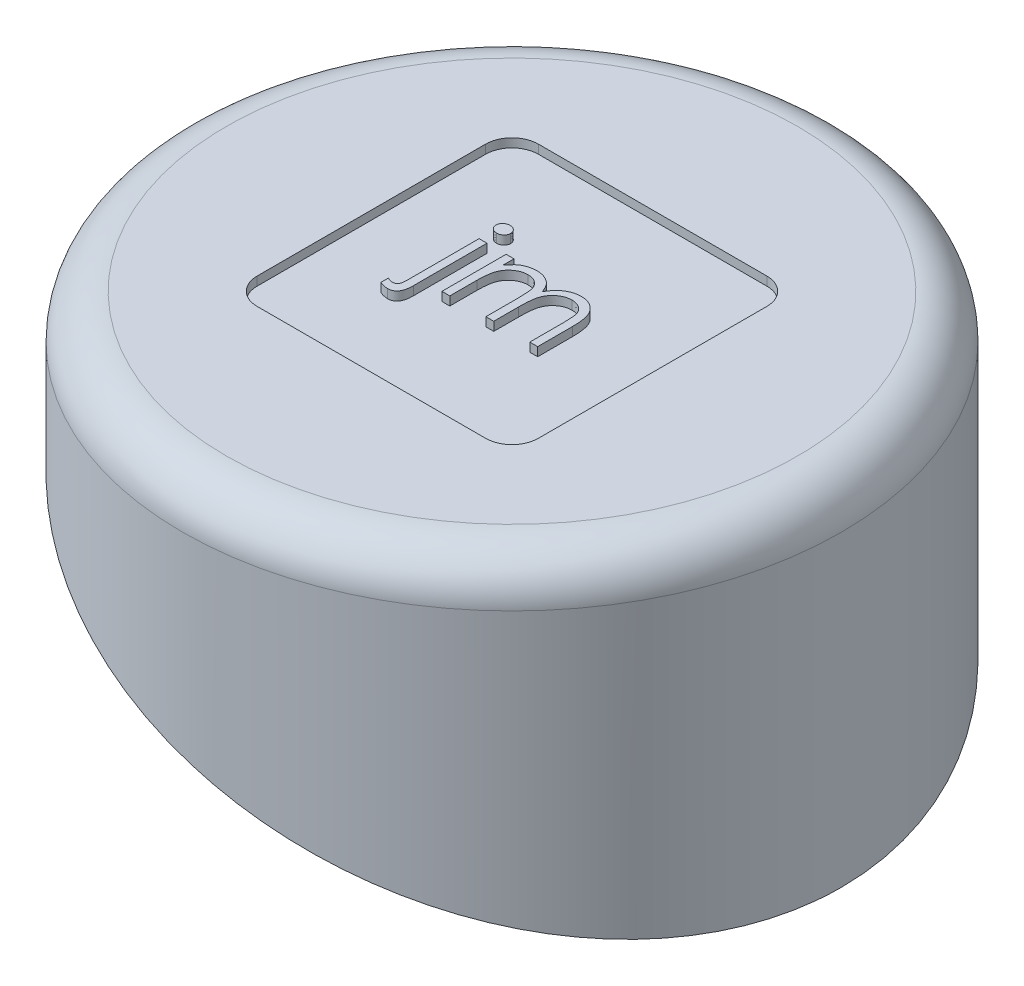
from build123d import *

# Parameters (mm, degrees)
SKETCH1_R                      = 37.5
BOSS_EXTRUDE1_DEPTH            = 40
CUT_EXTRUDE1_REACH             = 68.427
CUT_EXTRUDE1_DIRECTION_2_REACH = 68.427
FILLET1_R                      = 5
CUT_EXTRUDE2_DEPTH             = 1


# Read off the part's stored shape, not the designer's step: Shell1
with BuildPart() as part:
    # Sketch1 → Boss-Extrude1 (new body)
    with BuildSketch(Plane(origin=(0, 0, 0), x_dir=(1, 0, 0), z_dir=(0, 1, 0))):
        with Locations(Location((0, 0, 0), (0, 0, 270))):
            Circle(SKETCH1_R)
    extrude(amount=BOSS_EXTRUDE1_DEPTH)

    # Sketch2 → Cut-Extrude1 (cut, up to next)
    with BuildSketch(Plane.XY, mode=Mode.PRIVATE) as cut_extrude1_sk1:
        Polygon((37.5, 0), (-37.5, 0), (-37.5, 25.824570997), align=None)
    cut_extrude1_tool1 = extrude(cut_extrude1_sk1.sketch, amount=-CUT_EXTRUDE1_REACH, mode=Mode.PRIVATE) & part.part
    add(cut_extrude1_tool1.solids().sort_by_distance((-12.5, 8.60819, 0))[0], mode=Mode.SUBTRACT)

    # Sketch2 → Cut-Extrude1 direction 2 (cut, up to next)
    with BuildSketch(Plane.XY, mode=Mode.PRIVATE) as cut_extrude1_direction_2_sk1:
        Polygon((37.5, 0), (-37.5, 0), (-37.5, 25.824570997), align=None)
    cut_extrude1_direction_2_tool1 = extrude(cut_extrude1_direction_2_sk1.sketch, amount=CUT_EXTRUDE1_DIRECTION_2_REACH, mode=Mode.PRIVATE) & part.part
    add(cut_extrude1_direction_2_tool1.solids().sort_by_distance((-12.5, 8.60819, 0))[0], mode=Mode.SUBTRACT)

    # Fillet1
    fillet1_edges = [part.edges().sort_by_distance(p)[0] for p in [
        (0, 40, -37.5),
    ]]
    fillet(fillet1_edges, radius=FILLET1_R)

    # Shell1 outline → Shell1 (revolve, cut)
    with BuildSketch(Plane.XY):
        with BuildLine():
            Line((35, 0.854583606), (35, 35))
            ThreePointArc((35, 35), (34.267766953, 36.767766953), (32.5, 37.5))
            Line((32.5, 37.5), (0, 37.5))
            Line((0, 37.5), (0, 0.854583606))
            Line((0, 0.854583606), (35, 0.854583606))
        make_face()
    revolve(axis=Axis((0, 0, 0), (0, 1, 0)), mode=Mode.SUBTRACT)

    # Sketch3 → Cut-Extrude2 (cut)
    with BuildSketch(Plane(origin=(0, 40, 0), x_dir=(1, 0, 0), z_dir=(0, 1, 0))):
        with BuildLine():
            Line((-13, -16), (13, -16))
            ThreePointArc((13, -16), (15.121320344, -15.121320344), (16, -13))
            Line((16, -13), (16, 13))
            ThreePointArc((16, 13), (15.121320344, 15.121320344), (13, 16))
            Line((13, 16), (-13, 16))
            ThreePointArc((-13, 16), (-15.121320344, 15.121320344), (-16, 13))
            Line((-16, 13), (-16, -13))
            ThreePointArc((-16, -13), (-15.121320344, -15.121320344), (-13, -16))
        make_face()
        with BuildLine():
            add(Edge.make_bspline(
                [(-6.602564103, 6.384615385), (-6.546219207, 6.382051156), (-6.436523351, 6.377058951), (-6.278503166, 6.334172743), (-6.136327345, 6.259484797), (-6.009011428, 6.162468173), (-5.90222163, 6.045057839), (-5.824697029, 5.911307595), (-5.778834699, 5.764519327), (-5.772475164, 5.663112259), (-5.769230769, 5.611378205)],
                knots=[0, 0, 0, 0, 1.06928763, 2.081757757, 3.080304056, 4.102817284, 5.108909582, 6.075019406, 7.017947647, 8, 8, 8, 8], degree=3))
            add(Edge.make_bspline(
                [(-5.769230769, 5.611378205), (-5.772538286, 5.56098822), (-5.779063437, 5.461577616), (-5.824662885, 5.317314259), (-5.902869178, 5.185439169), (-6.008939934, 5.068256987), (-6.136346112, 4.971296003), (-6.278498143, 4.896593392), (-6.436524697, 4.85371111), (-6.546219664, 4.848718356), (-6.602564103, 4.846153846)],
                knots=[0, 0, 0, 0, 0.962634111, 1.899108286, 2.860048811, 3.872254101, 4.900980094, 5.905593535, 6.924215405, 8, 8, 8, 8], degree=3))
            add(Edge.make_bspline(
                [(-6.602564103, 4.846153846), (-6.658908541, 4.848718356), (-6.768603508, 4.85371111), (-6.926630062, 4.896593392), (-7.068782093, 4.971296003), (-7.196188271, 5.068256987), (-7.302259027, 5.185439169), (-7.38046532, 5.317314259), (-7.426064769, 5.461577616), (-7.432589919, 5.56098822), (-7.435897436, 5.611378205)],
                knots=[0, 0, 0, 0, 1.075784595, 2.094406465, 3.099019906, 4.127745899, 5.139951189, 6.100891714, 7.037365889, 8, 8, 8, 8], degree=3))
            add(Edge.make_bspline(
                [(-7.435897436, 5.611378205), (-7.432653041, 5.663112259), (-7.426293506, 5.764519327), (-7.380431176, 5.911307595), (-7.302906576, 6.045057839), (-7.196116777, 6.162468173), (-7.068800861, 6.259484797), (-6.926625039, 6.334172743), (-6.768604854, 6.377058951), (-6.658908998, 6.382051156), (-6.602564103, 6.384615385)],
                knots=[0, 0, 0, 0, 0.982052353, 1.924980594, 2.891090418, 3.897182716, 4.919695944, 5.918242243, 6.93071237, 8, 8, 8, 8], degree=3))
        make_face(mode=Mode.SUBTRACT)
        with BuildLine():
            Line((-7.051282051, 3.307692308), (-6.153846154, 3.307692308))
            Line((-6.153846154, 3.307692308), (-6.153846154, -5.067708333))
            add(Edge.make_bspline(
                [(-6.153846154, -5.067708333), (-6.154132606, -5.141869875), (-6.15468305, -5.284378053), (-6.172317042, -5.49016243), (-6.195192124, -5.680954673), (-6.228547736, -5.856533408), (-6.272681208, -6.016754586), (-6.326858883, -6.160593298), (-6.387799564, -6.291092499), (-6.463270778, -6.403491101), (-6.545332797, -6.502134381), (-6.634703123, -6.587487965), (-6.7308923, -6.660626224), (-6.836160171, -6.7180461), (-6.947081727, -6.765673789), (-7.066034551, -6.796368416), (-7.191389698, -6.817947311), (-7.277545042, -6.819643319), (-7.321714744, -6.820512821)],
                knots=[0, 0, 0, 0, 1.493029139, 2.868991889, 4.156754484, 5.362105958, 6.464967428, 7.499106053, 8.455465818, 9.358121702, 10.217355437, 11.035397588, 11.842309395, 12.643033568, 13.444773531, 14.266895717, 15.11148054, 16, 16, 16, 16], degree=3))
            add(Edge.make_bspline(
                [(-7.321714744, -6.820512821), (-7.399379833, -6.817829424), (-7.559893914, -6.812283524), (-7.806399323, -6.763785397), (-8.067320709, -6.692518214), (-8.242387038, -6.625144579), (-8.333333333, -6.590144231)],
                knots=[0, 0, 0, 0, 0.892368802, 1.844300437, 2.88012224, 4, 4, 4, 4], degree=3))
            Line((-8.333333333, -6.590144231), (-8.333333333, -5.726762821))
            add(Edge.make_bspline(
                [(-8.333333333, -5.726762821), (-8.276587466, -5.757025769), (-8.168310166, -5.814770775), (-8.002598459, -5.873223953), (-7.847373694, -5.916054943), (-7.745315187, -5.920799116), (-7.696314103, -5.923076923)],
                knots=[0, 0, 0, 0, 1.144578483, 2.183980519, 3.128079311, 4, 4, 4, 4], degree=3))
            add(Edge.make_bspline(
                [(-7.696314103, -5.923076923), (-7.639660339, -5.919438476), (-7.530400465, -5.912421532), (-7.378051109, -5.85186899), (-7.24962178, -5.749094843), (-7.190352916, -5.656726685), (-7.159455128, -5.608573718)],
                knots=[0, 0, 0, 0, 1.036054724, 1.998088038, 2.956371939, 4, 4, 4, 4], degree=3))
            add(Edge.make_bspline(
                [(-7.159455128, -5.608573718), (-7.141911229, -5.566290667), (-7.100858564, -5.467348473), (-7.072816103, -5.28222691), (-7.053144834, -5.04686094), (-7.051942097, -4.871484533), (-7.051282051, -4.775240385)],
                knots=[0, 0, 0, 0, 0.647276487, 1.514624746, 2.636060416, 4, 4, 4, 4], degree=3))
            Line((-7.051282051, -4.775240385), (-7.051282051, 3.307692308))
        make_face(mode=Mode.SUBTRACT)
        with BuildLine():
            Line((-3.974358974, 3.307692308), (-3.076923077, 3.307692308))
            Line((-3.076923077, 3.307692308), (-3.076923077, 2.037660256))
            add(Edge.make_bspline(
                [(-3.076923077, 2.037660256), (-2.996111791, 2.14876769), (-2.841269621, 2.361660184), (-2.587367757, 2.642203854), (-2.333721721, 2.880284296), (-2.151054916, 3.005263929), (-2.063301282, 3.065304487)],
                knots=[0, 0, 0, 0, 1.134379233, 2.173579362, 3.122582517, 4, 4, 4, 4], degree=3))
            add(Edge.make_bspline(
                [(-2.063301282, 3.065304487), (-1.943687962, 3.122462674), (-1.706551105, 3.235780426), (-1.331067605, 3.350733452), (-0.946854264, 3.421376598), (-0.687402224, 3.431037665), (-0.556891026, 3.435897436)],
                knots=[0, 0, 0, 0, 1.014936303, 2.012140481, 3.000054389, 4, 4, 4, 4], degree=3))
            add(Edge.make_bspline(
                [(-0.556891026, 3.435897436), (-0.468625321, 3.432910891), (-0.293952238, 3.427000679), (-0.035140552, 3.388543435), (0.215884053, 3.322068655), (0.457638423, 3.229476301), (0.685411792, 3.11734291), (0.894238071, 2.985772316), (1.081735809, 2.838066386), (1.247810241, 2.667555149), (1.397150314, 2.469450582), (1.534518447, 2.238409871), (1.661447625, 1.969245125), (1.731794222, 1.773912151), (1.768830128, 1.671073718)],
                knots=[0, 0, 0, 0, 1.009824226, 1.998387844, 2.986035974, 3.974953746, 4.955485308, 5.885931332, 6.793869504, 7.679848016, 8.601185859, 9.625726857, 10.749998409, 12, 12, 12, 12], degree=3))
            add(Edge.make_bspline(
                [(1.768830128, 1.671073718), (1.808005132, 1.741714916), (1.885096038, 1.880726873), (2.014540715, 2.077464765), (2.150162991, 2.26148417), (2.293118686, 2.432931097), (2.442903219, 2.590958898), (2.600221506, 2.736090046), (2.764178024, 2.868947799), (2.992155853, 3.024156826), (3.288763302, 3.189017345), (3.662729344, 3.331955756), (4.051729835, 3.420287551), (4.315780401, 3.430659759), (4.44911859, 3.435897436)],
                knots=[0, 0, 0, 0, 0.86119277, 1.694706429, 2.50939023, 3.298075842, 4.073795165, 4.829715201, 5.57930267, 6.321991688, 7.768977793, 9.186738141, 10.579381044, 12, 12, 12, 12], degree=3))
            add(Edge.make_bspline(
                [(4.44911859, 3.435897436), (4.571637055, 3.431276805), (4.811417587, 3.422233781), (5.160495489, 3.351223858), (5.486043504, 3.229287723), (5.787406579, 3.062905904), (6.05929176, 2.853822523), (6.295624072, 2.605054416), (6.494967967, 2.318361207), (6.625192652, 2.048669811), (6.713521979, 1.81056886), (6.767982648, 1.607693742), (6.816096063, 1.384403591), (6.856042478, 1.140431415), (6.885238341, 0.874915391), (6.906868956, 0.588290032), (6.921509167, 0.28033257), (6.922543659, 0.067859712), (6.923076923, -0.041666667)],
                knots=[0, 0, 0, 0, 1.209669288, 2.367440248, 3.500751976, 4.631527125, 5.755587489, 6.87532382, 8.007944318, 9.190864318, 9.82315674, 10.514484317, 11.263564316, 12.079023757, 12.955305781, 13.901327259, 14.918167583, 16, 16, 16, 16], degree=3))
            Line((6.923076923, -0.041666667), (6.923076923, -4))
            Line((6.923076923, -4), (6.025641026, -4))
            Line((6.025641026, -4), (6.025641026, -0.037660256))
            add(Edge.make_bspline(
                [(6.025641026, -0.037660256), (6.025418503, 0.055827098), (6.024990848, 0.235495574), (6.017294758, 0.493359721), (6.00279386, 0.72841217), (5.98583775, 0.940332422), (5.962284009, 1.129614675), (5.931867061, 1.295878728), (5.899645118, 1.440432474), (5.846113715, 1.600678325), (5.76054831, 1.777450355), (5.630212653, 1.968089143), (5.46601235, 2.134034286), (5.276411902, 2.27808662), (5.060559203, 2.395211309), (4.822659994, 2.478857051), (4.564191275, 2.530636703), (4.385269023, 2.535796748), (4.29286859, 2.538461538)],
                knots=[0, 0, 0, 0, 1.253487763, 2.409012846, 3.458416907, 4.410876679, 5.259312806, 6.014470957, 6.676830364, 7.243083969, 8.276244668, 9.299465089, 10.325150304, 11.392391894, 12.482080715, 13.603491619, 14.762376348, 16, 16, 16, 16], degree=3))
            add(Edge.make_bspline(
                [(4.29286859, 2.538461538), (4.179525863, 2.534415374), (3.955517545, 2.526418616), (3.628530442, 2.444778979), (3.314327537, 2.321692549), (3.0222843, 2.1433141), (2.75363347, 1.929575917), (2.522491819, 1.675434215), (2.331542717, 1.387920138), (2.202245643, 1.121786703), (2.120561925, 0.882731149), (2.06662788, 0.673881515), (2.024675333, 0.436505607), (1.985330964, 0.17219849), (1.959651741, -0.120859168), (1.936313535, -0.441311742), (1.925396784, -0.790123055), (1.923869759, -1.031913594), (1.923076923, -1.157451923)],
                knots=[0, 0, 0, 0, 1.090531906, 2.155305635, 3.229839962, 4.33261226, 5.44038871, 6.529323825, 7.629011124, 8.757537029, 9.370236727, 10.061839251, 10.834451254, 11.692844982, 12.636905849, 13.66920014, 14.789842145, 16, 16, 16, 16], degree=3))
            Line((1.923076923, -1.157451923), (1.923076923, -4))
            Line((1.923076923, -4), (1.025641026, -4))
            Line((1.025641026, -4), (1.025641026, -0.284054487))
            add(Edge.make_bspline(
                [(1.025641026, -0.284054487), (1.02541408, -0.179216434), (1.024977459, 0.022481444), (1.017330838, 0.311720516), (1.002797634, 0.574809317), (0.985996067, 0.81144207), (0.961824128, 1.021188724), (0.934367665, 1.205173747), (0.901943064, 1.362935893), (0.848257679, 1.535974135), (0.766216341, 1.726605344), (0.634249878, 1.929865404), (0.469656791, 2.107774254), (0.276597146, 2.259656393), (0.059438054, 2.385203482), (-0.18051452, 2.475659916), (-0.441099985, 2.528300743), (-0.620750573, 2.535010734), (-0.713141026, 2.538461538)],
                knots=[0, 0, 0, 0, 1.320475261, 2.540461679, 3.643808994, 4.639130445, 5.527981419, 6.302341397, 6.981980563, 7.553956391, 8.582137848, 9.585246428, 10.591171744, 11.620968678, 12.668337649, 13.738356861, 14.836885341, 16, 16, 16, 16], degree=3))
            add(Edge.make_bspline(
                [(-0.713141026, 2.538461538), (-0.821758773, 2.534088796), (-1.038230085, 2.525374074), (-1.356235713, 2.446933292), (-1.663337666, 2.324064507), (-1.954636805, 2.153607881), (-2.222277229, 1.942467656), (-2.456586564, 1.694139383), (-2.653565209, 1.411713573), (-2.784227537, 1.148386383), (-2.868508892, 0.915319883), (-2.924495562, 0.717174318), (-2.972608779, 0.497173609), (-3.008363126, 0.254639006), (-3.0428786, -0.008849835), (-3.059536626, -0.29460552), (-3.075741089, -0.602382913), (-3.076519417, -0.8148759), (-3.076923077, -0.925080128)],
                knots=[0, 0, 0, 0, 1.098833095, 2.189935336, 3.297829714, 4.440610912, 5.596351641, 6.740013378, 7.886572111, 9.072425424, 9.705826452, 10.395263256, 11.156850408, 11.985370555, 12.878090359, 13.847760091, 14.883794034, 16, 16, 16, 16], degree=3))
            Line((-3.076923077, -0.925080128), (-3.076923077, -4))
            Line((-3.076923077, -4), (-3.974358974, -4))
            Line((-3.974358974, -4), (-3.974358974, 3.307692308))
        make_face(mode=Mode.SUBTRACT)
    extrude(amount=-CUT_EXTRUDE2_DEPTH, mode=Mode.SUBTRACT)


solid = part.part
